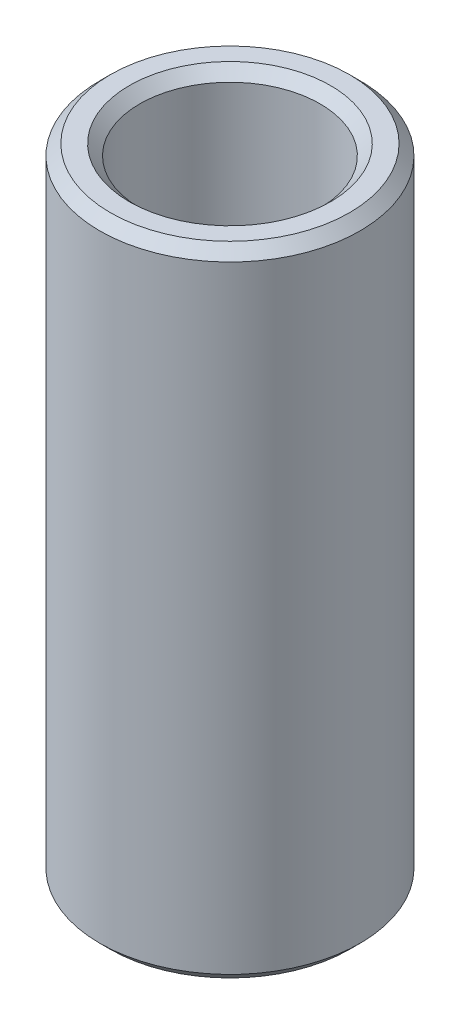
from build123d import *

# Parameters (mm, degrees)
SKETCH1_R           = 30
BOSS_EXTRUDE1_DEPTH = 147.086436941
SKETCH2_R           = 20.780865435
CUT_EXTRUDE1_DEPTH  = 154.083049134
CHAMFER1_SIZE       = 2.426636059


with BuildPart() as part:
    # Sketch1 → Boss-Extrude1 (new body)
    with BuildSketch(Plane(origin=(0, 0, 0), x_dir=(1, 0, 0), z_dir=(0, 1, 0))):
        Circle(SKETCH1_R)
    extrude(amount=BOSS_EXTRUDE1_DEPTH)

    # Sketch2 → Cut-Extrude1 (cut, through all)
    with BuildSketch(Plane(origin=(0, 0, 0), x_dir=(1, 0, 0), z_dir=(0, 1, 0))):
        Circle(SKETCH2_R)
    extrude(amount=CUT_EXTRUDE1_DEPTH, mode=Mode.SUBTRACT)

    # Chamfer1
    chamfer1_edges = [part.edges().sort_by_distance(p)[0] for p in [
        (-20.780865435, 147.086436941, 0),
        (-20.780865435, 0, 0),
        (-30, 0, 0),
        (-30, 147.086436941, 0),
    ]]
    chamfer(chamfer1_edges, length=CHAMFER1_SIZE)


solid = part.part
